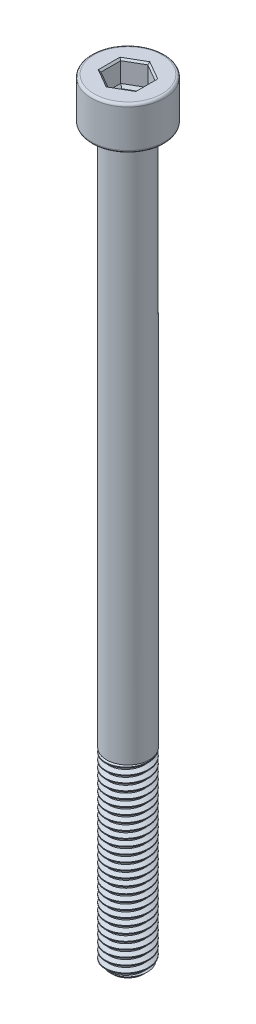
from build123d import *

# Parameters (mm, degrees)
SKETCH1_R           = 2.5
BOSS_EXTRUDE1_DEPTH = 22
THREAD1_PITCH       = 0.8
SKETCH2_R           = 2.5
BOSS_EXTRUDE2_DEPTH = 63
SKETCH3_R           = 4.25
BOSS_EXTRUDE3_DEPTH = 5
FILLET1_R           = 0.3
CUT_EXTRUDE1_DEPTH  = 2.5
CHAMFER1_SIZE       = 0.2
CUT_EXTRUDE2_DEPTH  = 0.3
CUT_EXTRUDE2_DRAFT  = -45


with BuildPart() as part:
    # Sketch1 → Boss-Extrude1 (new body)
    with BuildSketch(Plane(origin=(0, 0, 0), x_dir=(1, 0, 0), z_dir=(0, 1, 0))):
        with Locations(Location((0, 0, 0), (0, 0, 270))):
            Circle(SKETCH1_R)
    extrude(amount=BOSS_EXTRUDE1_DEPTH)

    # Thread1: arcs per turn and ends read off the stored shape
    # Thread1: the profile of Thread Profile1 profile screwed along a right-hand helix through 30 turns, 8 arcs to a turn; built about Z, then put on its axis
    thread1_z = Axis((0, 0, 0), (0, 0, 1))
    thread1_corners = [(2.5003, 0, -0.000173205), (2.5003, 0, 0.700173203), (2.0669873, 0, 0.449999999), (2.0669873, 0, 0.249999999)]
    with BuildLine(mode=Mode.PRIVATE) as thread1_profile:
        Line(thread1_corners[0], thread1_corners[1])
        Line(thread1_corners[1], thread1_corners[2])
        Line(thread1_corners[2], thread1_corners[3])
        Line(thread1_corners[3], thread1_corners[0])
    thread1_cap = Face(thread1_profile.wire())
    thread1_turn_angles = [0, 22.5, 45, 67.5, 90, 112.5, 135, 157.5, 180, 202.5, 225, 247.5, 270, 292.5, 315, 337.5, 360]
    thread1_turn_weights = [1, 0.9238795325112867, 1, 0.9238795325112867, 1, 0.9238795325112867, 1, 0.9238795325112867, 1, 0.9238795325112867, 1, 0.9238795325112867, 1, 0.9238795325112867, 1, 0.9238795325112867, 1]
    thread1_turn_rails = [Edge.make_bspline([Vector(p[0], p[1], 0).rotate(thread1_z, thread1_turn_angles[k]) / thread1_turn_weights[k] + Vector(0, 0, p[2] + THREAD1_PITCH * thread1_turn_angles[k] / 360) for k in range(17)], [0, 0, 0, 1, 1, 2, 2, 3, 3, 4, 4, 5, 5, 6, 6, 7, 7, 8, 8, 8], 2, thread1_turn_weights) for p in thread1_corners]
    thread1_turn_sides = [Face.make_surface_from_curves(thread1_turn_rails[p[0]], thread1_turn_rails[p[1]]) for p in [(0, 1), (1, 2), (2, 3), (3, 0)]]
    thread1 = Plane(origin=(0, 23, 0), x_dir=(-1, 0, 0), z_dir=(0, -1, 0)) * Solid(Shell([*[p.moved(Location((0, 0, THREAD1_PITCH * i))) for i in range(30) for p in thread1_turn_sides], thread1_cap, thread1_cap.rotate(thread1_z, 10800).moved(Location((0, 0, THREAD1_PITCH * 10800 / 360)))]))
    add(thread1, mode=Mode.SUBTRACT)

    # Sketch2 → Boss-Extrude2 (add)
    with BuildSketch(Plane(origin=(0, 22, 0), x_dir=(1, 0, 0), z_dir=(0, 1, 0))):
        with Locations(Location((0, 0, 0), (0, 0, 90))):
            Circle(SKETCH2_R)
    extrude(amount=BOSS_EXTRUDE2_DEPTH)

    # Sketch3 → Boss-Extrude3 (add)
    with BuildSketch(Plane(origin=(0, 85, 0), x_dir=(1, 0, 0), z_dir=(0, 1, 0))):
        with Locations(Location((0, 0, 0), (0, 0, 270))):
            Circle(SKETCH3_R)
    extrude(amount=BOSS_EXTRUDE3_DEPTH)

    # Fillet1
    fillet1_edges = [part.edges().sort_by_distance(p)[0] for p in [
        (0, 85, -4.25),
        (0, 90, -4.25),
    ]]
    fillet(fillet1_edges, radius=FILLET1_R)

    # Sketch4 → Cut-Revolve1 (revolve, cut)
    with BuildSketch(Plane.XY, mode=Mode.PRIVATE) as cut_revolve1_sk:
        Polygon((2.51, 0), (2.51, 0.7), (1.81, 0), align=None)
    revolve(cut_revolve1_sk.sketch.rotate(Axis((0, 0, 0), (0, 1, 0)), 90), axis=Axis((0, 0, 0), (0, 1, 0)), mode=Mode.SUBTRACT)

    # Sketch5 → Cut-Extrude1 (cut)
    with BuildSketch(Plane(origin=(0, 90, 0), x_dir=(1, 0, 0), z_dir=(0, 1, 0))):
        Polygon((0, 2.309401077), (-2, 1.154700538), (-2, -1.154700538), (0, -2.309401077), (2, -1.154700538), (2, 1.154700538), align=None)
    extrude(amount=-CUT_EXTRUDE1_DEPTH, mode=Mode.SUBTRACT)

    # Chamfer1
    chamfer1_edges = [part.edges().sort_by_distance(p)[0] for p in [
        (1, 90, -1.732050808),
        (-1, 90, -1.732050808),
        (-2, 90, 0),
        (-1, 90, 1.732050808),
        (1, 90, 1.732050808),
        (2, 90, 0),
    ]]
    chamfer(chamfer1_edges, length=CHAMFER1_SIZE)


with BuildPart() as cut_extrude2_tool:
    # Sketch6 → Cut-Extrude2 (with draft: the straight prism first)
    with BuildSketch(Plane(origin=(0, 87.5, 0), x_dir=(1, 0, 0), z_dir=(0, 1, 0))):
        Polygon((0, 2.309401077), (-2, 1.154700538), (-2, -1.154700538), (0, -2.309401077), (2, -1.154700538), (2, 1.154700538), align=None)
    extrude(amount=-CUT_EXTRUDE2_DEPTH)
    # Cut-Extrude2: the draft: its side faces are tilted about the plane it starts from
    cut_extrude2_sides = [cut_extrude2_tool.faces().sort_by_distance(p)[0] for p in [
        (-1, 87.35, -1.732050808),
        (-2, 87.35, 0),
        (-1, 87.35, 1.732050808),
        (1, 87.35, 1.732050808),
        (2, 87.35, 0),
        (1, 87.35, -1.732050808),
    ]]
    draft(cut_extrude2_sides, Plane(origin=(0, 87.5, 0), x_dir=(1, 0, 0), z_dir=(0, 1, 0)), CUT_EXTRUDE2_DRAFT)


with BuildPart() as part_1:
    add(part.part)

    # Cut-Extrude2: cut by cut_extrude2_tool
    add(cut_extrude2_tool.part, mode=Mode.SUBTRACT)


solid = part_1.part
